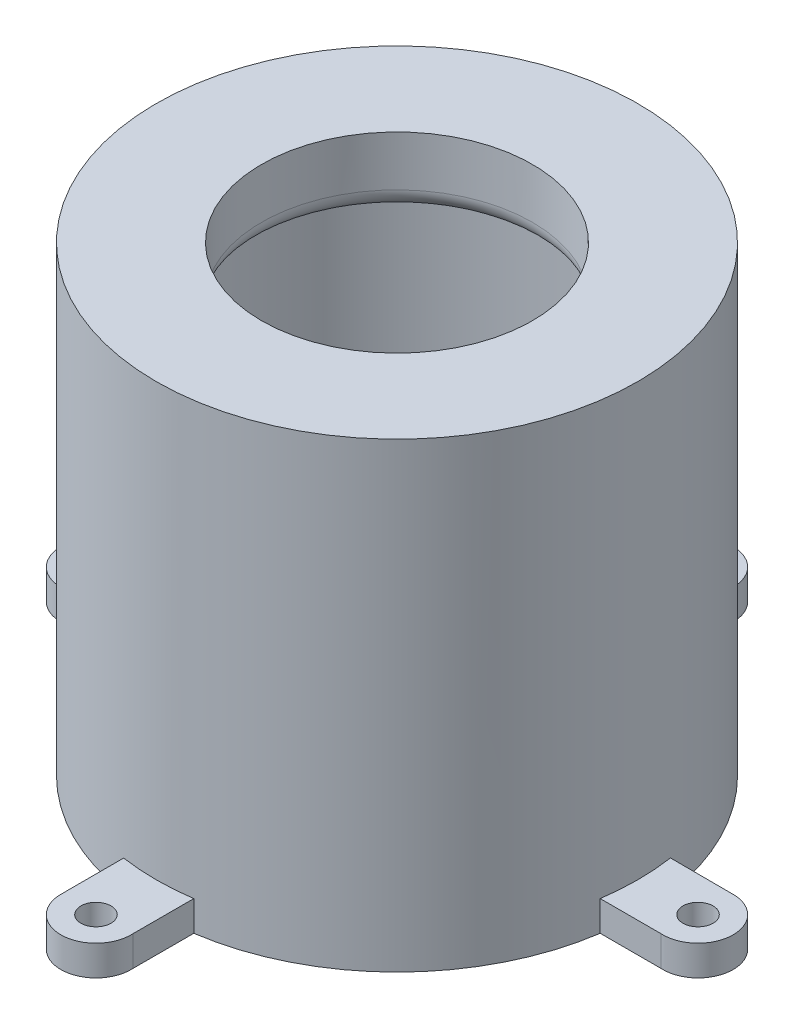
from build123d import *

# Parameters (mm, degrees)
SKETCH1_R           = 1.5
SKETCH1_R_2         = 20
BOSS_EXTRUDE1_DEPTH = 3
SKETCH2_R           = 24
SKETCH2_R_2         = 20
BOSS_EXTRUDE2_DEPTH = 40
SKETCH3_R           = 24
BOSS_EXTRUDE3_DEPTH = 3
SKETCH4_R           = 13.5
CUT_EXTRUDE1_DEPTH  = 67.034082109
SKETCH5_R           = 15.5
SKETCH5_R_2         = 13.5
BOSS_EXTRUDE4_DEPTH = 4
FILLET1_R           = 1
FILLET2_R           = 2


with BuildPart() as part:
    # Sketch1 → Boss-Extrude1 (new body)
    with BuildSketch(Plane(origin=(0, 0, 0), x_dir=(1, 0, 0), z_dir=(0, 1, 0))):
        with BuildLine():
            ThreePointArc((-29.774250944, 3.673415402), (-29.785177171, 3.58374398), (-29.795833333, 3.494040065))
            ThreePointArc((-29.795833333, 3.494040065), (-33.5, 0), (-29.795833333, -3.494040065))
            Line((-29.795833333, -3.494040065), (-23.744297927, -3.494040065))
            ThreePointArc((-23.744297927, -3.494040065), (-16.972692501, -16.968432728), (-3.5, -23.743420141))
            Line((-3.5, -23.743420141), (-3.5, -29.795133831))
            ThreePointArc((-3.5, -29.795133831), (-3.49702005, -29.795483731), (-3.494040065, -29.795833333))
            ThreePointArc((-3.494040065, -29.795833333), (0, -33.5), (3.494040064, -29.795833333))
            Line((3.494040064, -29.795833333), (3.494040064, -23.744297927))
            ThreePointArc((3.494040064, -23.744297927), (16.970562748, -16.970562749), (23.744297927, -3.494040065))
            Line((23.744297927, -3.494040065), (29.795833333, -3.494040065))
            ThreePointArc((29.795833333, -3.494040064), (33.5, 0), (29.795833333, 3.494040064))
            Line((29.795833333, 3.494040064), (23.741608141, 3.512270334))
            ThreePointArc((23.741608141, 3.512270334), (16.964046346, 16.97707665), (3.494040064, 23.744297927))
            Line((3.494040064, 23.744297927), (3.494040064, 29.795833333))
            ThreePointArc((3.494040064, 29.795833333), (0, 33.5), (-3.494040065, 29.795833333))
            ThreePointArc((-3.494040064, 29.795833333), (-3.49702005, 29.795483731), (-3.5, 29.795133831))
            Line((-3.5, 29.795133831), (-3.5, 23.743420141))
            ThreePointArc((-3.5, 23.743420141), (-16.914985868, 17.025958213), (-23.720025751, 3.655185133))
            Line((-23.720025751, 3.655185133), (-29.774250944, 3.673415402))
        make_face()
        with Locations(Location((0, -30, 0), (0, 0, 270))):
            Circle(SKETCH1_R, mode=Mode.SUBTRACT)
        with Locations(Location((-30, 0, 0), (0, 0, 270))):
            Circle(SKETCH1_R, mode=Mode.SUBTRACT)
        with Locations(Location((0, 0, 0), (0, 0, 270))):
            Circle(SKETCH1_R_2, mode=Mode.SUBTRACT)
        with Locations(Location((0, 30, 0), (0, 0, 270))):
            Circle(SKETCH1_R, mode=Mode.SUBTRACT)
        with Locations(Location((30, 0, 0), (0, 0, 270))):
            Circle(SKETCH1_R, mode=Mode.SUBTRACT)
    extrude(amount=BOSS_EXTRUDE1_DEPTH)

    # Sketch2 → Boss-Extrude2 (add)
    with BuildSketch(Plane(origin=(0, 3, 0), x_dir=(1, 0, 0), z_dir=(0, 1, 0))):
        with Locations(Location((0, 0, 0), (0, 0, 81.628843141))):
            Circle(SKETCH2_R)
        with Locations(Location((0, 0, 0), (0, 0, 270))):
            Circle(SKETCH2_R_2, mode=Mode.SUBTRACT)
    extrude(amount=BOSS_EXTRUDE2_DEPTH)

    # Sketch3 → Boss-Extrude3 (add)
    with BuildSketch(Plane(origin=(0, 43, 0), x_dir=(1, 0, 0), z_dir=(0, 1, 0))):
        with Locations(Location((0, 0, 0), (0, 0, 81.628843141))):
            Circle(SKETCH3_R)
    extrude(amount=BOSS_EXTRUDE3_DEPTH)

    # Sketch4 → Cut-Extrude1 (cut, through all)
    with BuildSketch(Plane(origin=(0, 46, 0), x_dir=(1, 0, 0), z_dir=(0, 1, 0))):
        with Locations(Location((0, 0, 0), (0, 0, 270))):
            Circle(SKETCH4_R)
    extrude(amount=-CUT_EXTRUDE1_DEPTH, mode=Mode.SUBTRACT)

    # Sketch5 → Boss-Extrude4 (add)
    with BuildSketch(Plane.XZ.offset(-43)):
        with Locations(Location((0, 0, 0), (0, 0, 90))):
            Circle(SKETCH5_R)
        with Locations(Location((0, 0, 0), (0, 0, 90))):
            Circle(SKETCH5_R_2, mode=Mode.SUBTRACT)
    extrude(amount=BOSS_EXTRUDE4_DEPTH)

    # Fillet1
    fillet1_edges = [part.edges().sort_by_distance(p)[0] for p in [
        (0, 43, -15.5),
    ]]
    fillet(fillet1_edges, radius=FILLET1_R)

    # Fillet2
    fillet2_edges = [part.edges().sort_by_distance(p)[0] for p in [
        (0, 39, -13.5),
    ]]
    fillet(fillet2_edges, radius=FILLET2_R - 0.0001)  # a hair under: the kernel refuses the full size


solid = part.part
